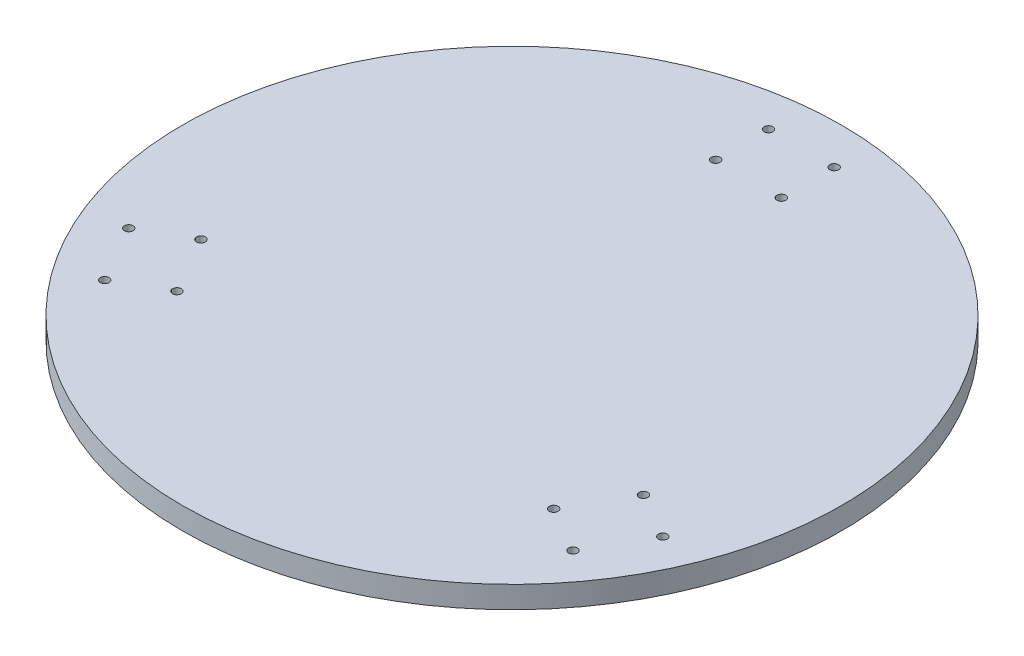
from build123d import *

# Parameters (mm, degrees)
SKETCH1_R           = 150
BOSS_EXTRUDE1_DEPTH = 10
SKETCH2_R           = 2
CUT_EXTRUDE2_DEPTH  = 10


with BuildPart() as part:
    # Sketch1 → Boss-Extrude1 (new body)
    with BuildSketch(Plane(origin=(0, 0, 0), x_dir=(1, 0, 0), z_dir=(0, 1, 0))):
        Circle(SKETCH1_R)
    extrude(amount=BOSS_EXTRUDE1_DEPTH)

    # Sketch2 → Cut-Extrude2 (cut)
    with BuildSketch(Plane(origin=(0, 10, 0), x_dir=(1, 0, 0), z_dir=(0, 1, 0))):
        with Locations((-14.95, 131.71)):
            Circle(SKETCH2_R)
        with Locations((-14.95, 107.65)):
            Circle(SKETCH2_R)
        with Locations((14.95, 131.71)):
            Circle(SKETCH2_R)
        with Locations((14.95, 107.65)):
            Circle(SKETCH2_R)
        with Locations((121.539205932, -52.907920213)):
            Circle(SKETCH2_R)
        with Locations((106.589205932, -78.802079787)):
            Circle(SKETCH2_R)
        with Locations((100.702634717, -40.877920213)):
            Circle(SKETCH2_R)
        with Locations((85.752634717, -66.772079787)):
            Circle(SKETCH2_R)
        with Locations((-106.589205932, -78.802079787)):
            Circle(SKETCH2_R)
        with Locations((-121.539205932, -52.907920213)):
            Circle(SKETCH2_R)
        with Locations((-85.752634717, -66.772079787)):
            Circle(SKETCH2_R)
        with Locations((-100.702634717, -40.877920213)):
            Circle(SKETCH2_R)
    extrude(amount=-CUT_EXTRUDE2_DEPTH, mode=Mode.SUBTRACT)


solid = part.part
